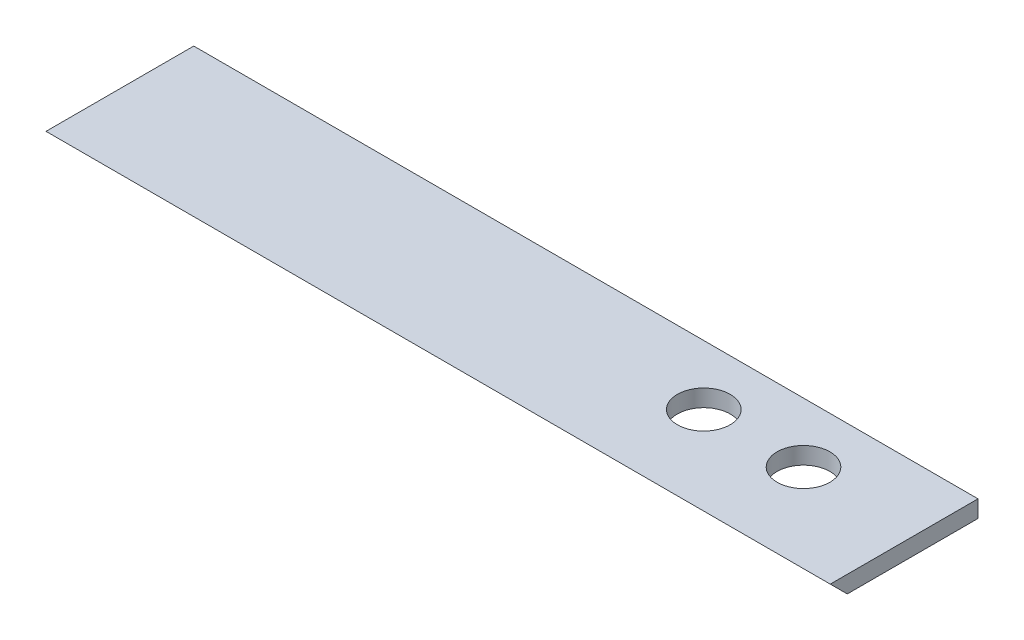
from build123d import *

# Parameters (mm, degrees)
SKETCH1_W           = 876.3
SKETCH1_H           = 165.1
BOSS_EXTRUDE1_DEPTH = 19.05
SKETCH3_R           = 29.499999928
CUT_EXTRUDE1_DEPTH  = 19.05
SKETCH2_R           = 29.499999928
CUT_EXTRUDE2_DEPTH  = 19.05
CUT_EXTRUDE3_DEPTH  = 914.4


with BuildPart() as part:
    # Sketch1 → Boss-Extrude1 (new body)
    with BuildSketch(Plane(origin=(0, 0, 0), x_dir=(1, 0, 0), z_dir=(0, 1, 0))):
        with Locations((375.34945696, 66.731818106)):
            Rectangle(SKETCH1_W, SKETCH1_H)
    extrude(amount=BOSS_EXTRUDE1_DEPTH)

    # Sketch3 → Cut-Extrude1 (cut)
    with BuildSketch(Plane(origin=(0, 19.05, 0), x_dir=(1, 0, 0), z_dir=(0, 1, 0))):
        with Locations((573.905935058, 82.4588113)):
            Circle(SKETCH3_R)
    extrude(amount=-CUT_EXTRUDE1_DEPTH, mode=Mode.SUBTRACT)

    # Sketch2 → Cut-Extrude2 (cut)
    with BuildSketch(Plane(origin=(0, 19.05, 0), x_dir=(1, 0, 0), z_dir=(0, 1, 0))):
        with Locations((685.24027425, 82.567946762)):
            Circle(SKETCH2_R)
    extrude(amount=-CUT_EXTRUDE2_DEPTH, mode=Mode.SUBTRACT)

    # Sketch4 → Cut-Extrude3 (cut)
    with BuildSketch(Plane.ZY.offset(62.80054304)):
        Polygon((-3.231818106, 0), (15.818181894, 19.05), (15.818181894, 0), align=None)
    extrude(amount=-CUT_EXTRUDE3_DEPTH, mode=Mode.SUBTRACT)


solid = part.part
